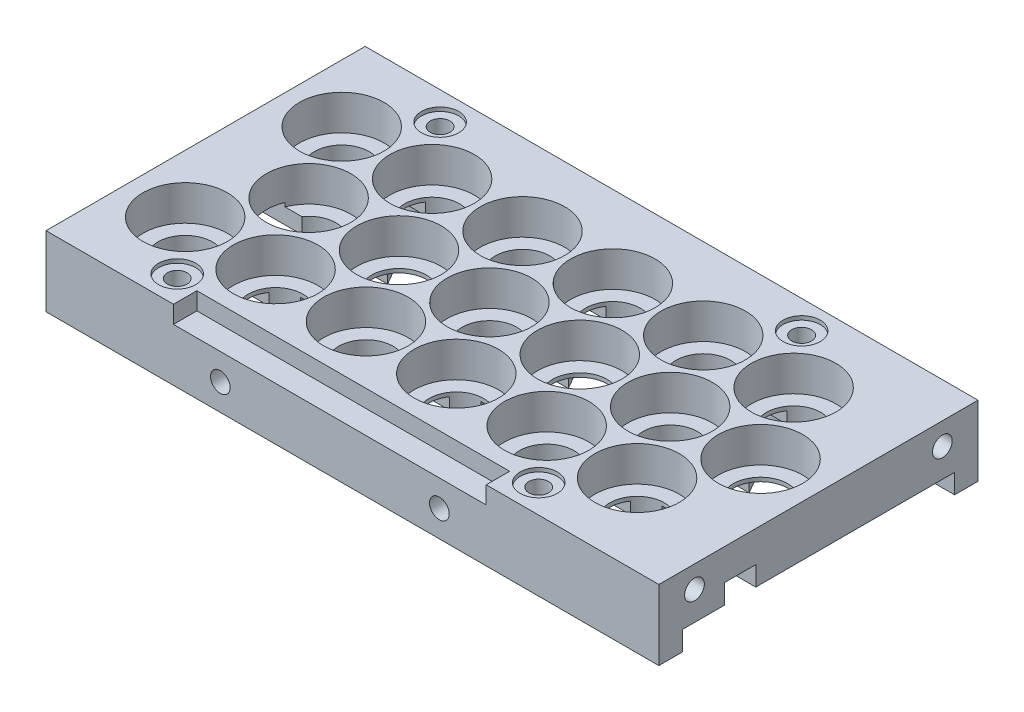
from build123d import *

# Parameters (mm, degrees)
BOSS_EXTRUDE2_DEPTH      = 11
BOSS_EXTRUDE2_DEPTH_BACK = 2
SKETCH1_W                = 156.975
SKETCH1_H                = 81.746976195
SKETCH1_R                = 10.825
BOSS_EXTRUDE3_DEPTH      = 2
BOSS_EXTRUDE3_DEPTH_BACK = 2
SKETCH1_3_R              = 10.825
SKETCH1_3_R_2            = 7
CUT_EXTRUDE3_REACH       = 157.2
SKETCH9_R                = 2.525
SKETCH10_R               = 4.7625
CUT_EXTRUDE4_DEPTH       = 1
SKETCH13_R               = 6.5
BOSS_EXTRUDE7_DEPTH      = 5
CUT_EXTRUDE1_DEPTH       = 3
SKETCH19_W               = 80.1
SKETCH19_H               = 4.475
CUT_EXTRUDE6_DEPTH       = 6
SKETCH20_R               = 2.525
CUT_EXTRUDE7_DEPTH       = 3.8862
SKETCH22_R               = 2.525
CUT_EXTRUDE8_DEPTH       = 3.81
SKETCH26_R               = 1.9431
CUT_EXTRUDE9_DEPTH       = 5
CUT_EXTRUDE10_DEPTH      = 5
SKETCH28_R               = 1.9431
CUT_EXTRUDE11_DEPTH      = 5


with BuildPart() as part:
    # Sketch1 → Boss-Extrude2 (new, two sides: drawn at the far end of the back side and taken through both)
    with BuildSketch(Plane(origin=(0, 0, 0), x_dir=(1, 0, 0), z_dir=(0, 1, 0)).offset(-BOSS_EXTRUDE2_DEPTH_BACK)):
        with Locations((63.6625, -20.048488098)):
            Rectangle(SKETCH1_W, SKETCH1_H)
        with Locations((0, -40.096976195)):
            Circle(SKETCH1_R, mode=Mode.SUBTRACT)
        with Locations((23.15, -40.096976195)):
            Circle(SKETCH1_R, mode=Mode.SUBTRACT)
        with Locations((46.3, -40.096976195)):
            Circle(SKETCH1_R, mode=Mode.SUBTRACT)
        with Locations((69.45, -40.096976195)):
            Circle(SKETCH1_R, mode=Mode.SUBTRACT)
        with Locations((92.6, -40.096976195)):
            Circle(SKETCH1_R, mode=Mode.SUBTRACT)
        with Locations((115.75, -40.096976195)):
            Circle(SKETCH1_R, mode=Mode.SUBTRACT)
        with Locations((11.575, -20.048488098)):
            Circle(SKETCH1_R, mode=Mode.SUBTRACT)
        Circle(SKETCH1_R, mode=Mode.SUBTRACT)
        with Locations((23.15, 0)):
            Circle(SKETCH1_R, mode=Mode.SUBTRACT)
        with Locations((34.725, -20.048488098)):
            Circle(SKETCH1_R, mode=Mode.SUBTRACT)
        with Locations((57.875, -20.048488098)):
            Circle(SKETCH1_R, mode=Mode.SUBTRACT)
        with Locations((46.3, 0)):
            Circle(SKETCH1_R, mode=Mode.SUBTRACT)
        with Locations((81.025, -20.048488098)):
            Circle(SKETCH1_R, mode=Mode.SUBTRACT)
        with Locations((69.45, 0)):
            Circle(SKETCH1_R, mode=Mode.SUBTRACT)
        with Locations((92.6, 0)):
            Circle(SKETCH1_R, mode=Mode.SUBTRACT)
        with Locations((104.175, -20.048488098)):
            Circle(SKETCH1_R, mode=Mode.SUBTRACT)
        with Locations((127.325, -20.048488098)):
            Circle(SKETCH1_R, mode=Mode.SUBTRACT)
        with Locations((115.75, 0)):
            Circle(SKETCH1_R, mode=Mode.SUBTRACT)
    extrude(amount=BOSS_EXTRUDE2_DEPTH + BOSS_EXTRUDE2_DEPTH_BACK)

    # Sketch1<3> → Boss-Extrude3 (add, two sides: drawn at the far end of the back side and taken through both)
    # profile 1 of 18: a face of its own
    with BuildSketch(Plane(origin=(0, 0, 0), x_dir=(1, 0, 0), z_dir=(0, 1, 0)).offset(-BOSS_EXTRUDE3_DEPTH_BACK)):
        Circle(SKETCH1_3_R)
        Circle(SKETCH1_3_R_2, mode=Mode.SUBTRACT)
    # profile 2 of 18: a face of its own
    with BuildSketch(Plane(origin=(0, 0, 0), x_dir=(1, 0, 0), z_dir=(0, 1, 0)).offset(-BOSS_EXTRUDE3_DEPTH_BACK)):
        with Locations((11.575, -20.048488098)):
            Circle(SKETCH1_3_R)
        with Locations((11.575, -20.048488098)):
            Circle(SKETCH1_3_R_2, mode=Mode.SUBTRACT)
    # profile 3 of 18: a face of its own
    with BuildSketch(Plane(origin=(0, 0, 0), x_dir=(1, 0, 0), z_dir=(0, 1, 0)).offset(-BOSS_EXTRUDE3_DEPTH_BACK)):
        with Locations((0, -40.096976195)):
            Circle(SKETCH1_3_R)
        with Locations((0, -40.096976195)):
            Circle(SKETCH1_3_R_2, mode=Mode.SUBTRACT)
    # profile 4 of 18: a face of its own
    with BuildSketch(Plane(origin=(0, 0, 0), x_dir=(1, 0, 0), z_dir=(0, 1, 0)).offset(-BOSS_EXTRUDE3_DEPTH_BACK)):
        with Locations((23.15, 0)):
            Circle(SKETCH1_3_R)
        with Locations((23.15, 0)):
            Circle(SKETCH1_3_R_2, mode=Mode.SUBTRACT)
    # profile 5 of 18: a face of its own
    with BuildSketch(Plane(origin=(0, 0, 0), x_dir=(1, 0, 0), z_dir=(0, 1, 0)).offset(-BOSS_EXTRUDE3_DEPTH_BACK)):
        with Locations((34.725, -20.048488098)):
            Circle(SKETCH1_3_R)
        with Locations((34.725, -20.048488098)):
            Circle(SKETCH1_3_R_2, mode=Mode.SUBTRACT)
    # profile 6 of 18: a face of its own
    with BuildSketch(Plane(origin=(0, 0, 0), x_dir=(1, 0, 0), z_dir=(0, 1, 0)).offset(-BOSS_EXTRUDE3_DEPTH_BACK)):
        with Locations((23.15, -40.096976195)):
            Circle(SKETCH1_3_R)
        with Locations((23.15, -40.096976195)):
            Circle(SKETCH1_3_R_2, mode=Mode.SUBTRACT)
    # profile 7 of 18: a face of its own
    with BuildSketch(Plane(origin=(0, 0, 0), x_dir=(1, 0, 0), z_dir=(0, 1, 0)).offset(-BOSS_EXTRUDE3_DEPTH_BACK)):
        with Locations((46.3, 0)):
            Circle(SKETCH1_3_R)
        with Locations((46.3, 0)):
            Circle(SKETCH1_3_R_2, mode=Mode.SUBTRACT)
    # profile 8 of 18: a face of its own
    with BuildSketch(Plane(origin=(0, 0, 0), x_dir=(1, 0, 0), z_dir=(0, 1, 0)).offset(-BOSS_EXTRUDE3_DEPTH_BACK)):
        with Locations((57.875, -20.048488098)):
            Circle(SKETCH1_3_R)
        with Locations((57.875, -20.048488098)):
            Circle(SKETCH1_3_R_2, mode=Mode.SUBTRACT)
    # profile 9 of 18: a face of its own
    with BuildSketch(Plane(origin=(0, 0, 0), x_dir=(1, 0, 0), z_dir=(0, 1, 0)).offset(-BOSS_EXTRUDE3_DEPTH_BACK)):
        with Locations((46.3, -40.096976195)):
            Circle(SKETCH1_3_R)
        with Locations((46.3, -40.096976195)):
            Circle(SKETCH1_3_R_2, mode=Mode.SUBTRACT)
    # profile 10 of 18: a face of its own
    with BuildSketch(Plane(origin=(0, 0, 0), x_dir=(1, 0, 0), z_dir=(0, 1, 0)).offset(-BOSS_EXTRUDE3_DEPTH_BACK)):
        with Locations((69.45, 0)):
            Circle(SKETCH1_3_R)
        with Locations((69.45, 0)):
            Circle(SKETCH1_3_R_2, mode=Mode.SUBTRACT)
    # profile 11 of 18: a face of its own
    with BuildSketch(Plane(origin=(0, 0, 0), x_dir=(1, 0, 0), z_dir=(0, 1, 0)).offset(-BOSS_EXTRUDE3_DEPTH_BACK)):
        with Locations((81.025, -20.048488098)):
            Circle(SKETCH1_3_R)
        with Locations((81.025, -20.048488098)):
            Circle(SKETCH1_3_R_2, mode=Mode.SUBTRACT)
    # profile 12 of 18: a face of its own
    with BuildSketch(Plane(origin=(0, 0, 0), x_dir=(1, 0, 0), z_dir=(0, 1, 0)).offset(-BOSS_EXTRUDE3_DEPTH_BACK)):
        with Locations((69.45, -40.096976195)):
            Circle(SKETCH1_3_R)
        with Locations((69.45, -40.096976195)):
            Circle(SKETCH1_3_R_2, mode=Mode.SUBTRACT)
    # profile 13 of 18: a face of its own
    with BuildSketch(Plane(origin=(0, 0, 0), x_dir=(1, 0, 0), z_dir=(0, 1, 0)).offset(-BOSS_EXTRUDE3_DEPTH_BACK)):
        with Locations((92.6, 0)):
            Circle(SKETCH1_3_R)
        with Locations((92.6, 0)):
            Circle(SKETCH1_3_R_2, mode=Mode.SUBTRACT)
    # profile 14 of 18: a face of its own
    with BuildSketch(Plane(origin=(0, 0, 0), x_dir=(1, 0, 0), z_dir=(0, 1, 0)).offset(-BOSS_EXTRUDE3_DEPTH_BACK)):
        with Locations((104.175, -20.048488098)):
            Circle(SKETCH1_3_R)
        with Locations((104.175, -20.048488098)):
            Circle(SKETCH1_3_R_2, mode=Mode.SUBTRACT)
    # profile 15 of 18: a face of its own
    with BuildSketch(Plane(origin=(0, 0, 0), x_dir=(1, 0, 0), z_dir=(0, 1, 0)).offset(-BOSS_EXTRUDE3_DEPTH_BACK)):
        with Locations((92.6, -40.096976195)):
            Circle(SKETCH1_3_R)
        with Locations((92.6, -40.096976195)):
            Circle(SKETCH1_3_R_2, mode=Mode.SUBTRACT)
    # profile 16 of 18: a face of its own
    with BuildSketch(Plane(origin=(0, 0, 0), x_dir=(1, 0, 0), z_dir=(0, 1, 0)).offset(-BOSS_EXTRUDE3_DEPTH_BACK)):
        with Locations((115.75, 0)):
            Circle(SKETCH1_3_R)
        with Locations((115.75, 0)):
            Circle(SKETCH1_3_R_2, mode=Mode.SUBTRACT)
    # profile 17 of 18: a face of its own
    with BuildSketch(Plane(origin=(0, 0, 0), x_dir=(1, 0, 0), z_dir=(0, 1, 0)).offset(-BOSS_EXTRUDE3_DEPTH_BACK)):
        with Locations((127.325, -20.048488098)):
            Circle(SKETCH1_3_R)
        with Locations((127.325, -20.048488098)):
            Circle(SKETCH1_3_R_2, mode=Mode.SUBTRACT)
    # profile 18 of 18: a face of its own
    with BuildSketch(Plane(origin=(0, 0, 0), x_dir=(1, 0, 0), z_dir=(0, 1, 0)).offset(-BOSS_EXTRUDE3_DEPTH_BACK)):
        with Locations((115.75, -40.096976195)):
            Circle(SKETCH1_3_R)
        with Locations((115.75, -40.096976195)):
            Circle(SKETCH1_3_R_2, mode=Mode.SUBTRACT)
    extrude(amount=BOSS_EXTRUDE3_DEPTH + BOSS_EXTRUDE3_DEPTH_BACK)

    # Sketch9 → Cut-Extrude3 (cut, up to next)
    with BuildSketch(Plane(origin=(0, 11, 0), x_dir=(1, 0, 0), z_dir=(0, 1, 0)), mode=Mode.PRIVATE) as cut_extrude3_sk1:
        with Locations((11.575, 13.625)):
            Circle(SKETCH9_R)
    cut_extrude3_tool1 = extrude(cut_extrude3_sk1.sketch, amount=-CUT_EXTRUDE3_REACH, mode=Mode.PRIVATE) & part.part
    # Sketch9 → Cut-Extrude3 (cut, up to next)
    with BuildSketch(Plane(origin=(0, 11, 0), x_dir=(1, 0, 0), z_dir=(0, 1, 0)), mode=Mode.PRIVATE) as cut_extrude3_sk2:
        with Locations((11.575, -53.721976195)):
            Circle(SKETCH9_R)
    cut_extrude3_tool2 = extrude(cut_extrude3_sk2.sketch, amount=-CUT_EXTRUDE3_REACH, mode=Mode.PRIVATE) & part.part
    # Sketch9 → Cut-Extrude3 (cut, up to next)
    with BuildSketch(Plane(origin=(0, 11, 0), x_dir=(1, 0, 0), z_dir=(0, 1, 0)), mode=Mode.PRIVATE) as cut_extrude3_sk3:
        with Locations((104.175, -53.721976195)):
            Circle(SKETCH9_R)
    cut_extrude3_tool3 = extrude(cut_extrude3_sk3.sketch, amount=-CUT_EXTRUDE3_REACH, mode=Mode.PRIVATE) & part.part
    # Sketch9 → Cut-Extrude3 (cut, up to next)
    with BuildSketch(Plane(origin=(0, 11, 0), x_dir=(1, 0, 0), z_dir=(0, 1, 0)), mode=Mode.PRIVATE) as cut_extrude3_sk4:
        with Locations((104.175, 13.625)):
            Circle(SKETCH9_R)
    cut_extrude3_tool4 = extrude(cut_extrude3_sk4.sketch, amount=-CUT_EXTRUDE3_REACH, mode=Mode.PRIVATE) & part.part
    add(cut_extrude3_tool1.solids().sort_by_distance((11.575, 11, -13.625))[0], mode=Mode.SUBTRACT)
    add(cut_extrude3_tool2.solids().sort_by_distance((11.575, 11, 53.721976))[0], mode=Mode.SUBTRACT)
    add(cut_extrude3_tool3.solids().sort_by_distance((104.175, 11, 53.721976))[0], mode=Mode.SUBTRACT)
    add(cut_extrude3_tool4.solids().sort_by_distance((104.175, 11, -13.625))[0], mode=Mode.SUBTRACT)

    # Sketch10 → Cut-Extrude4 (cut)
    with BuildSketch(Plane(origin=(0, 11, 0), x_dir=(1, 0, 0), z_dir=(0, 1, 0))):
        with Locations((11.575, 13.625)):
            Circle(SKETCH10_R)
        with Locations((104.175, 13.625)):
            Circle(SKETCH10_R)
        with Locations((104.175, -53.721976195)):
            Circle(SKETCH10_R)
        with Locations((11.575, -53.721976195)):
            Circle(SKETCH10_R)
    extrude(amount=-CUT_EXTRUDE4_DEPTH, mode=Mode.SUBTRACT)

    # Sketch13 → Boss-Extrude7 (add)
    # profile 1 of 2: a face of its own
    with BuildSketch(Plane.XZ.offset(2)):
        with BuildLine():
            ThreePointArc((3.665512027, 54.921976195), (11.575, 45.721976195), (19.484487973, 54.921976195))
            Line((19.484487973, 54.921976195), (96.265512027, 54.921976195))
            ThreePointArc((96.265512027, 54.921976195), (104.175, 45.721976195), (112.084487973, 54.921976195))
            Line((112.084487973, 54.921976195), (142.15, 54.921976195))
            Line((142.15, 54.921976195), (142.15, 60.921976195))
            Line((142.15, 60.921976195), (-14.825, 60.921976195))
            Line((-14.825, 60.921976195), (-14.825, 54.921976195))
            Line((-14.825, 54.921976195), (3.665512027, 54.921976195))
        make_face()
        with Locations((11.575, 53.721976195)):
            Circle(SKETCH13_R, mode=Mode.SUBTRACT)
        with Locations((104.175, 53.721976195)):
            Circle(SKETCH13_R, mode=Mode.SUBTRACT)
    # profile 2 of 2: a face of its own
    with BuildSketch(Plane.XZ.offset(2)):
        with BuildLine():
            Line((-14.825, -14.825), (-14.825, -20.825))
            Line((-14.825, -20.825), (142.15, -20.825))
            Line((142.15, -20.825), (142.15, -14.825))
            Line((142.15, -14.825), (112.084487973, -14.825))
            ThreePointArc((112.084487973, -14.825), (104.175, -5.625), (96.265512027, -14.825))
            Line((96.265512027, -14.825), (19.484487973, -14.825))
            ThreePointArc((19.484487973, -14.825), (11.575, -5.625), (3.665512027, -14.825))
            Line((3.665512027, -14.825), (-14.825, -14.825))
        make_face()
        with Locations((11.575, -13.625)):
            Circle(SKETCH13_R, mode=Mode.SUBTRACT)
        with Locations((104.175, -13.625)):
            Circle(SKETCH13_R, mode=Mode.SUBTRACT)
    extrude(amount=BOSS_EXTRUDE7_DEPTH)

    # Sketch2 → Cut-Extrude1 (cut)
    with BuildSketch(Plane.XZ.offset(2)):
        with BuildLine():
            Line((23.15, 44.096976195), (0, 44.096976195))
            ThreePointArc((0, 44.096976195), (-4, 40.096976195), (0, 36.096976195))
            Line((0, 36.096976195), (20.840598923, 36.096976195))
            Line((20.840598923, 36.096976195), (27.79679677, 24.048488098))
            Line((27.79679677, 24.048488098), (13.884401077, 24.048488098))
            Line((13.884401077, 24.048488098), (15.039101615, 22.048488098))
            ThreePointArc((15.039101615, 22.048488098), (15.575, 20.048488098), (15.039101615, 18.048488098))
            Line((15.039101615, 18.048488098), (13.884401077, 16.048488098))
            Line((13.884401077, 16.048488098), (27.79679677, 16.048488098))
            Line((27.79679677, 16.048488098), (20.840598923, 4))
            Line((20.840598923, 4), (0, 4))
            ThreePointArc((0, 4), (-4, 0), (0, -4))
            Line((0, -4), (23.14999999, -4))
            ThreePointArc((23.14999999, -4), (25.149999995, -3.464101618), (26.614101615, -2))
            Line((26.614101615, -2), (37.034401077, 16.048488098))
            Line((37.034401077, 16.048488098), (34.725, 16.048488098))
            ThreePointArc((34.725, 16.048488098), (32.725, 16.584386482), (31.260898385, 18.048488098))
            Line((31.260898385, 18.048488098), (30.106197846, 20.048488098))
            Line((30.106197846, 20.048488098), (31.260898385, 22.048488098))
            ThreePointArc((31.260898385, 22.048488098), (32.725, 23.512589713), (34.725, 24.048488098))
            Line((34.725, 24.048488098), (37.034401077, 24.048488098))
            Line((37.034401077, 24.048488098), (26.614101615, 42.096976195))
            ThreePointArc((26.614101615, 42.096976195), (25.15, 43.56107781), (23.15, 44.096976195))
        make_face()
        with BuildLine():
            Line((69.45, 44.096976195), (46.3, 44.096976195))
            ThreePointArc((46.3, 44.096976195), (42.835898385, 42.096976195), (42.835898385, 38.096976195))
            Line((42.835898385, 38.096976195), (43.990598923, 36.096976195))
            Line((43.990598923, 36.096976195), (67.140598923, 36.096976195))
            Line((67.140598923, 36.096976195), (74.09679677, 24.048488098))
            Line((74.09679677, 24.048488098), (60.184401077, 24.048488098))
            Line((60.184401077, 24.048488098), (61.339101615, 22.048488098))
            ThreePointArc((61.339101615, 22.048488098), (61.875, 20.048488098), (61.339101615, 18.048488098))
            Line((61.339101615, 18.048488098), (60.184401077, 16.048488098))
            Line((60.184401077, 16.048488098), (74.09679677, 16.048488098))
            Line((74.09679677, 16.048488098), (67.140598923, 4))
            Line((67.140598923, 4), (43.990598923, 4))
            Line((43.990598923, 4), (42.835898385, 2))
            ThreePointArc((42.835898385, 2), (42.835898385, -2), (46.3, -4))
            Line((46.3, -4), (69.45, -4))
            ThreePointArc((69.45, -4), (71.45, -3.464101615), (72.914101615, -2))
            Line((72.914101615, -2), (83.334401077, 16.048488098))
            Line((83.334401077, 16.048488098), (81.025, 16.048488098))
            ThreePointArc((81.025, 16.048488098), (79.025, 16.584386482), (77.560898385, 18.048488098))
            Line((77.560898385, 18.048488098), (76.406197846, 20.048488098))
            Line((76.406197846, 20.048488098), (77.560898385, 22.048488098))
            ThreePointArc((77.560898385, 22.048488098), (79.025, 23.512589713), (81.025, 24.048488098))
            Line((81.025, 24.048488098), (83.334401077, 24.048488098))
            Line((83.334401077, 24.048488098), (72.914101615, 42.096976195))
            ThreePointArc((72.914101615, 42.096976195), (71.45, 43.56107781), (69.45, 44.096976195))
        make_face()
        with BuildLine():
            Line((115.75, 44.096976195), (92.6, 44.096976195))
            ThreePointArc((92.6, 44.096976195), (89.135898385, 42.096976195), (89.135898385, 38.096976195))
            Line((89.135898385, 38.096976195), (90.290598923, 36.096976195))
            Line((90.290598923, 36.096976195), (113.440598923, 36.096976195))
            Line((113.440598923, 36.096976195), (112.285898385, 38.096976195))
            ThreePointArc((112.285898385, 38.096976195), (112.285898385, 42.096976195), (115.75, 44.096976195))
        make_face()
        with BuildLine():
            Line((130.789101615, 22.048488098), (119.214101615, 42.096976195))
            ThreePointArc((119.214101615, 42.096976195), (119.214101615, 38.096976195), (115.75, 36.096976195))
            Line((115.75, 36.096976195), (113.440598923, 36.096976195))
            Line((113.440598923, 36.096976195), (120.39679677, 24.048488098))
            Line((120.39679677, 24.048488098), (106.484401077, 24.048488098))
            Line((106.484401077, 24.048488098), (107.639101615, 22.048488098))
            ThreePointArc((107.639101615, 22.048488098), (108.175, 20.048488098), (107.639101615, 18.048488098))
            Line((107.639101615, 18.048488098), (106.484401077, 16.048488098))
            Line((106.484401077, 16.048488098), (120.39679677, 16.048488098))
            Line((120.39679677, 16.048488098), (113.440598923, 4))
            Line((113.440598923, 4), (115.75, 4))
            ThreePointArc((115.75, 4), (119.214101615, 2), (119.214101615, -2))
            Line((119.214101615, -2), (130.789101615, 18.048488098))
            ThreePointArc((130.789101615, 18.048488098), (127.325, 16.048488098), (123.860898385, 18.048488098))
            Line((123.860898385, 18.048488098), (122.706197846, 20.048488098))
            Line((122.706197846, 20.048488098), (123.860898385, 22.048488098))
            ThreePointArc((123.860898385, 22.048488098), (127.325, 24.048488098), (130.789101615, 22.048488098))
        make_face()
        with BuildLine():
            Line((113.440598923, 4), (90.290598923, 4))
            Line((90.290598923, 4), (89.135898385, 2))
            ThreePointArc((89.135898385, 2), (89.135898385, -2), (92.6, -4))
            Line((92.6, -4), (115.75, -4))
            ThreePointArc((115.75, -4), (112.285898385, -2), (112.285898385, 2))
            Line((112.285898385, 2), (113.440598923, 4))
        make_face()
    extrude(amount=-CUT_EXTRUDE1_DEPTH, mode=Mode.SUBTRACT)

    # Sketch19 → Cut-Extrude6 (cut)
    with BuildSketch(Plane.XY.offset(60.921976195)):
        with Locations((57.875, 8.7625)):
            Rectangle(SKETCH19_W, SKETCH19_H)
    extrude(amount=-CUT_EXTRUDE6_DEPTH, mode=Mode.SUBTRACT)

    # Sketch20 → Cut-Extrude7 (cut)
    with BuildSketch(Plane.XY.offset(60.921976195)):
        with Locations((29.825, -0.2375)):
            Circle(SKETCH20_R)
        with Locations((85.925, -0.2375)):
            Circle(SKETCH20_R)
    extrude(amount=-CUT_EXTRUDE7_DEPTH, mode=Mode.SUBTRACT)

    # Sketch22 → Cut-Extrude8 (cut)
    with BuildSketch(Plane(origin=(142.15, 0, 0), x_dir=(0, 0, -1), z_dir=(1, 0, 0))):
        with Locations((-51.798488098, 5.325)):
            Circle(SKETCH22_R)
        with Locations((11.701511902, 5.325)):
            Circle(SKETCH22_R)
    extrude(amount=-CUT_EXTRUDE8_DEPTH, mode=Mode.SUBTRACT)

    # Sketch26 → Cut-Extrude9 (cut)
    with BuildSketch(Plane.XZ.offset(2)):
        with Locations((132.15, -9.4125)):
            Circle(SKETCH26_R)
        with Locations((57.875, -9.4125)):
            Circle(SKETCH26_R)
        with Locations((-10.825, -9.4125)):
            Circle(SKETCH26_R)
        with Locations((-10.825, 49.509476195)):
            Circle(SKETCH26_R)
        with Locations((57.875, 49.509476195)):
            Circle(SKETCH26_R)
        with Locations((132.15, 49.509476195)):
            Circle(SKETCH26_R)
    extrude(amount=-CUT_EXTRUDE9_DEPTH, mode=Mode.SUBTRACT)

    # Sketch27 → Cut-Extrude10 (cut)
    with BuildSketch(Plane.XZ.offset(2)):
        with BuildLine():
            Line((11.575, 16.048488098), (-14.825, 16.048488098))
            ThreePointArc((-14.825, 16.048488098), (-18.825, 20.048488098), (-14.825, 24.048488098))
            Line((-14.825, 24.048488098), (11.575, 24.048488098))
            ThreePointArc((11.575, 24.048488098), (15.575, 20.048488098), (11.575, 16.048488098))
        make_face()
        with BuildLine():
            Line((115.75, 44.096976195), (142.15, 44.096976195))
            ThreePointArc((142.15, 44.096976195), (146.15, 40.096976195), (142.15, 36.096976195))
            Line((142.15, 36.096976195), (115.75, 36.096976195))
            ThreePointArc((115.75, 36.096976195), (111.75, 40.096976195), (115.75, 44.096976195))
        make_face()
    extrude(amount=-CUT_EXTRUDE10_DEPTH, mode=Mode.SUBTRACT)

    # Sketch28 → Cut-Extrude11 (cut)
    with BuildSketch(Plane.XZ.offset(-3)):
        with Locations((-10.825, 20.048488098)):
            Circle(SKETCH28_R)
        with Locations((-3.25, 20.048488098)):
            Circle(SKETCH28_R)
        with Locations((130.575, 40.096976195)):
            Circle(SKETCH28_R)
        with Locations((138.15, 40.096976195)):
            Circle(SKETCH28_R)
    extrude(amount=-CUT_EXTRUDE11_DEPTH, mode=Mode.SUBTRACT)


solid = part.part
